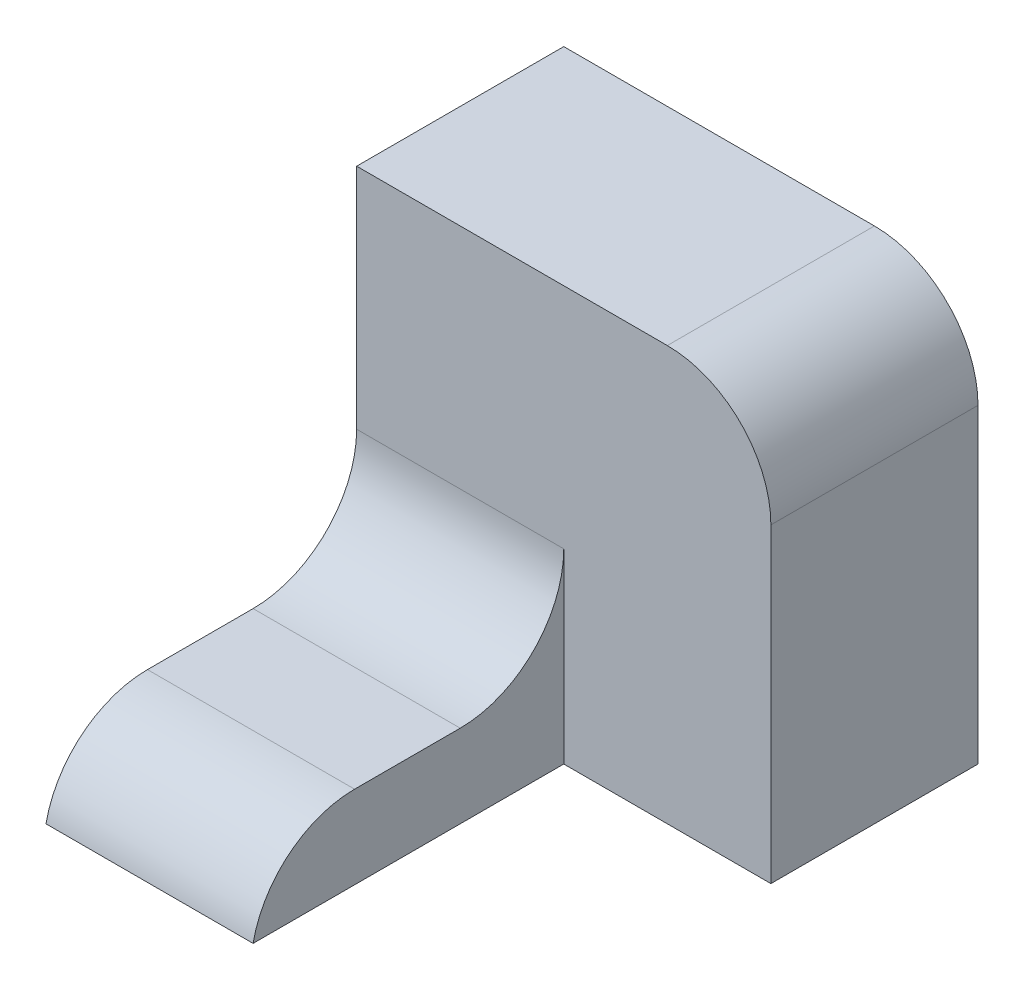
from build123d import *

# Parameters (mm, degrees)
SKETCH1_W           = 20
SKETCH1_H           = 8
BOSS_EXTRUDE1_DEPTH = 30
SKETCH2_W           = 40
SKETCH2_H           = 40
BOSS_EXTRUDE2_DEPTH = 20
FILLET1_R           = 10


with BuildPart() as part:
    # Sketch1 → Boss-Extrude1 (new body)
    with BuildSketch(Plane.XY):
        with Locations((-20, -4)):
            Rectangle(SKETCH1_W, SKETCH1_H)
    extrude(amount=BOSS_EXTRUDE1_DEPTH)

    # Sketch2 → Boss-Extrude2 (add)
    with BuildSketch(Plane.XY):
        with Locations((-10, 12)):
            Rectangle(SKETCH2_W, SKETCH2_H)
    extrude(amount=-BOSS_EXTRUDE2_DEPTH)

    # Fillet1
    # the kernel refuses this fillet: 10 mm, written as the material it adds along each edge
    with BuildSketch(Plane(origin=(-10, 0, 0), x_dir=(0, 1, 0), z_dir=(-1, 0, 0))) as fillet1_piece_1:
        with BuildLine():
            CenterArc((FILLET1_R, -FILLET1_R), FILLET1_R, 90, 90)
            Line((0, -FILLET1_R), (0, 0))
            Line((0, 0), (FILLET1_R, 0))
        make_face()
    extrude(amount=20)
    # the kernel refuses this fillet: 10 mm, written as the material it takes off along each edge
    with BuildSketch(Plane(origin=(10, 32, 25), x_dir=(-1, 0, 0), z_dir=(0, 0, -1))) as fillet1_2_piece_1:
        with BuildLine():
            CenterArc((FILLET1_R, -FILLET1_R), FILLET1_R, 90, 90)
            Line((0, -FILLET1_R), (0, 0))
            Line((0, 0), (FILLET1_R, 0))
        make_face()
    extrude(amount=70, mode=Mode.SUBTRACT)
    with BuildSketch(Plane(origin=(14.494897428, 0, 30), x_dir=(0, 0, -1), z_dir=(-1, 0, 0))) as fillet1_2_piece_2:
        with BuildLine():
            CenterArc((9.797958971, 10), FILLET1_R, 191.536959033, 78.463040967)
            Line((0, 8), (0, 0))
            Line((0, 0), (9.797958971, 0))
        make_face()
    extrude(amount=68.989794856, mode=Mode.SUBTRACT)


solid = part.part
